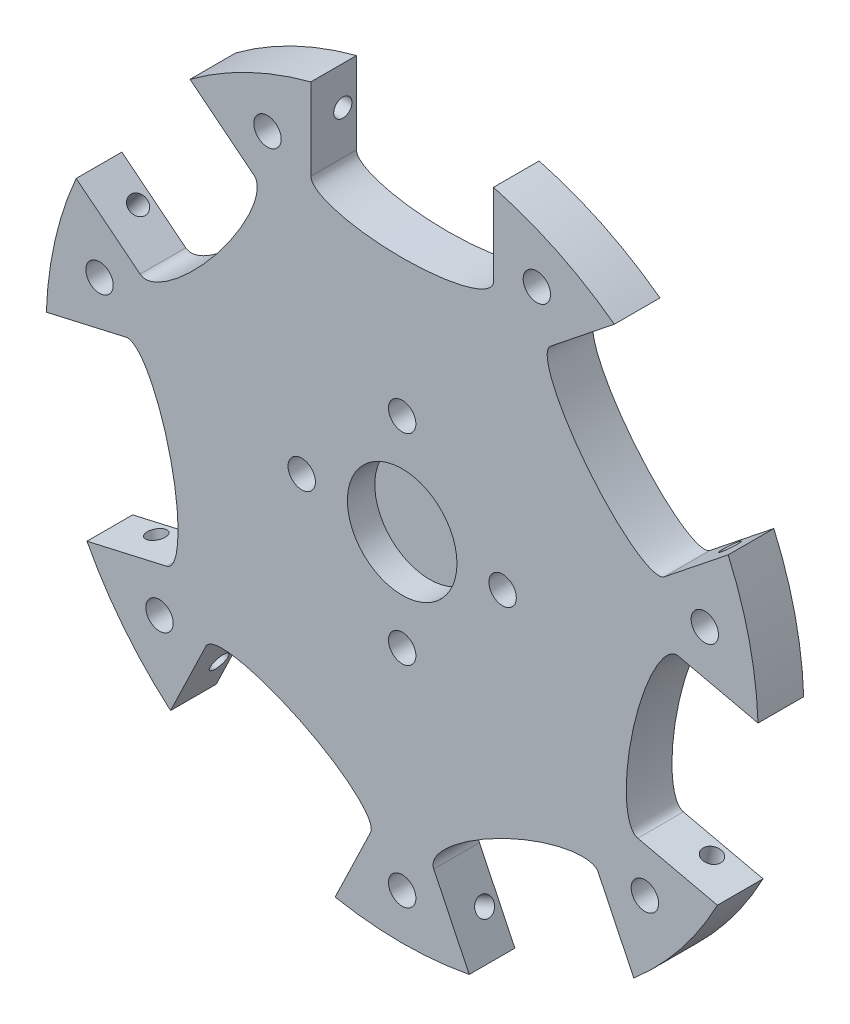
from build123d import *

# Parameters (mm, degrees)
EXTRUDE_2_DEPTH          = 5
SKETCH_3_R               = 1.5
SKETCH_3_R_2             = 6
CUT_EXTRUDE_2_DEPTH      = 3
SKETCH_6_R               = 1
CUT_EXTRUDE_5_DEPTH      = 13
PATTERN_CIRCULAR_1_COUNT = 7
SCALE_1_DEPTH            = 5
SCALE_1_2_DEPTH          = 0.783063807
SCALE_START              = 4.198063807
SCALE_1_3_OUTLINE_R      = 1.5
SCALE_1_3_OUTLINE_R_2    = 6
SCALE_1_3_DEPTH          = 0.801936193
SCALE_START_2            = 2.149063807
SCALE_1_4_OUTLINE_R      = 1.0245
SCALE_1_4_DEPTH          = 2.049
SCALE_START_3            = 2
SCALE_1_5_OUTLINE_R      = 1.5
SCALE_1_5_OUTLINE_R_2    = 6
SCALE_1_5_OUTLINE_R_3    = 4.098
SCALE_1_5_DEPTH          = 2.198063807
SCALE_1_6_OUTLINE_R      = 4.098
SCALE_1_6_DEPTH          = 0.149063807


with BuildPart() as part:
    # 草图1 → 凸台-拉伸2 (new body)
    with BuildSketch(Plane.XY):
        with BuildLine():
            Line((-10, 28.75), (-10, 37.69615365))
            ThreePointArc((-10, 37.69615365), (-16.921465826, 35.137785848), (-23.237141673, 31.321482195))
            Line((-23.237141673, 31.321482195), (-16.242757102, 25.743646628))
            add(Edge.make_bspline(
                [(-28.71255314, 10.107016979), (-26.562516563, 8.392420024), (-20.327618544, 16.210734848), (-14.092720526, 24.029049673), (-16.242757102, 25.743646628)],
                knots=[3.141592654, 3.141592654, 3.141592654, 4.71238898, 4.71238898, 6.283185307, 6.283185307, 6.283185307], degree=2, weights=[1, 0.707106781, 1, 0.707106781, 1]))
            Line((-28.71255314, 10.107016979), (-35.70693771, 15.684852545))
            ThreePointArc((-35.70693771, 15.684852545), (-38.022188575, 8.678316424), (-38.976241715, 1.361095805))
            Line((-38.976241715, 1.361095805), (-30.254386815, 3.351802271))
            add(Edge.make_bspline(
                [(-25.803968136, -16.146755973), (-23.122916377, -15.534823405), (-25.348125717, -5.785544283), (-27.573335056, 3.963734839), (-30.254386815, 3.351802271)],
                knots=[3.141592654, 3.141592654, 3.141592654, 4.71238898, 4.71238898, 6.283185307, 6.283185307, 6.283185307], degree=2, weights=[1, 0.707106781, 1, 0.707106781, 1]))
            Line((-25.803968136, -16.146755973), (-34.525823036, -18.137462439))
            ThreePointArc((-34.525823036, -18.137462439), (-30.491427816, -24.316102272), (-25.365436775, -29.624223487))
            Line((-25.365436775, -29.624223487), (-21.483846179, -21.564017561))
            add(Edge.make_bspline(
                [(-3.464468821, -30.241692343), (-2.271288538, -27.764027957), (-11.280977217, -23.425190565), (-20.290665896, -19.086353174), (-21.483846179, -21.564017561)],
                knots=[3.141592654, 3.141592654, 3.141592654, 4.71238898, 4.71238898, 6.283185307, 6.283185307, 6.283185307], degree=2, weights=[1, 0.707106781, 1, 0.707106781, 1]))
            Line((-3.464468821, -30.241692343), (-7.346059417, -38.301898269))
            ThreePointArc((-7.346059417, -38.301898269), (0, -39), (7.346059417, -38.301898269))
            Line((7.346059417, -38.301898269), (3.464468821, -30.241692343))
            add(Edge.make_bspline(
                [(21.483846179, -21.564017561), (20.290665896, -19.086353174), (11.280977217, -23.425190565), (2.271288538, -27.764027957), (3.464468821, -30.241692343)],
                knots=[3.141592654, 3.141592654, 3.141592654, 4.71238898, 4.71238898, 6.283185307, 6.283185307, 6.283185307], degree=2, weights=[1, 0.707106781, 1, 0.707106781, 1]))
            Line((21.483846179, -21.564017561), (25.365436775, -29.624223487))
            ThreePointArc((25.365436775, -29.624223487), (30.491427816, -24.316102272), (34.525823036, -18.137462439))
            Line((34.525823036, -18.137462439), (25.803968136, -16.146755973))
            add(Edge.make_bspline(
                [(30.254386815, 3.351802271), (27.573335056, 3.963734839), (25.348125717, -5.785544283), (23.122916377, -15.534823405), (25.803968136, -16.146755973)],
                knots=[3.141592654, 3.141592654, 3.141592654, 4.71238898, 4.71238898, 6.283185307, 6.283185307, 6.283185307], degree=2, weights=[1, 0.707106781, 1, 0.707106781, 1]))
            Line((30.254386815, 3.351802271), (38.976241715, 1.361095805))
            ThreePointArc((38.976241715, 1.361095805), (38.022188575, 8.678316424), (35.70693771, 15.684852545))
            Line((35.70693771, 15.684852545), (28.71255314, 10.107016979))
            add(Edge.make_bspline(
                [(16.242757102, 25.743646628), (14.092720526, 24.029049673), (20.327618544, 16.210734848), (26.562516563, 8.392420024), (28.71255314, 10.107016979)],
                knots=[3.141592654, 3.141592654, 3.141592654, 4.71238898, 4.71238898, 6.283185307, 6.283185307, 6.283185307], degree=2, weights=[1, 0.707106781, 1, 0.707106781, 1]))
            Line((16.242757102, 25.743646628), (23.237141673, 31.321482195))
            ThreePointArc((23.237141673, 31.321482195), (16.921465826, 35.137785848), (10, 37.69615365))
            Line((10, 37.69615365), (10, 28.75))
            add(Edge.make_bspline(
                [(-10, 28.75), (-10, 26), (0, 26), (10, 26), (10, 28.75)],
                knots=[3.141592654, 3.141592654, 3.141592654, 4.71238898, 4.71238898, 6.283185307, 6.283185307, 6.283185307], degree=2, weights=[1, 0.707106781, 1, 0.707106781, 1]))
        make_face()
    extrude(amount=EXTRUDE_2_DEPTH)

    # 草图3 → 切除-拉伸2 (cut)
    with BuildSketch(Plane.XY.offset(5)):
        with Locations((0, 11)):
            Circle(SKETCH_3_R)
        with Locations((11, 0)):
            Circle(SKETCH_3_R)
        with Locations((0, -11)):
            Circle(SKETCH_3_R)
        with Locations((-11, 0)):
            Circle(SKETCH_3_R)
        Circle(SKETCH_3_R_2)
        with Locations((14.75204713, 30.632941509)):
            Circle(SKETCH_3_R)
        with Locations((33.147549014, 7.565711755)):
            Circle(SKETCH_3_R)
        with Locations((26.582270404, -21.198653263)):
            Circle(SKETCH_3_R)
        with Locations((0, -34)):
            Circle(SKETCH_3_R)
        with Locations((-26.582270404, -21.198653263)):
            Circle(SKETCH_3_R)
        with Locations((-33.147549014, 7.565711755)):
            Circle(SKETCH_3_R)
        with Locations((-14.75204713, 30.632941509)):
            Circle(SKETCH_3_R)
    extrude(amount=-CUT_EXTRUDE_2_DEPTH, mode=Mode.SUBTRACT)

    # 草图6 → 切除-拉伸5 (cut, symmetric)
    with BuildSketch(Plane(origin=(0, 0, 0), x_dir=(0, 0, -1), z_dir=(1, 0, 0))):
        with Locations((-1.5, 33.5)):
            Circle(SKETCH_6_R)
    cut_extrude_5 = extrude(amount=CUT_EXTRUDE_5_DEPTH, both=True, mode=Mode.SUBTRACT)

    # 阵列(圆周)1: 切除-拉伸5 ×7 about axis
    pattern_circular_1_axis = Axis((0, 0, 0), (0, 0, 1))
    for i in range(1, PATTERN_CIRCULAR_1_COUNT):
        add(cut_extrude_5.rotate(pattern_circular_1_axis, i * 360 / PATTERN_CIRCULAR_1_COUNT), mode=Mode.SUBTRACT)

    # 缩放比例1: read off the stored shape, not the designer's step
    # 缩放比例1 outline → 缩放比例1 (cut)
    with BuildSketch(Plane.XY):
        with BuildLine():
            Line((10, 37.69615365), (10, 28.75))
            add(Edge.make_bspline(
                [(10, 28.75), (10, 26), (0, 26), (-10, 26), (-10, 28.75)],
                knots=[0, 0, 0, 1.570796327, 1.570796327, 3.141592654, 3.141592654, 3.141592654], degree=2, weights=[1, 0.707106781, 1, 0.707106781, 1]))
            Line((-10, 28.75), (-10, 37.69615365))
            ThreePointArc((-10, 37.69615365), (-16.921465826, 35.137785848), (-23.237141673, 31.321482195))
            Line((-23.237141673, 31.321482195), (-16.242757102, 25.743646628))
            add(Edge.make_bspline(
                [(-16.242757102, 25.743646628), (-14.092720526, 24.029049673), (-20.327618544, 16.210734848), (-26.562516563, 8.392420024), (-28.71255314, 10.107016979)],
                knots=[0, 0, 0, 1.570796327, 1.570796327, 3.141592654, 3.141592654, 3.141592654], degree=2, weights=[1, 0.707106781, 1, 0.707106781, 1]))
            Line((-28.71255314, 10.107016979), (-35.70693771, 15.684852545))
            ThreePointArc((-35.70693771, 15.684852545), (-38.022188575, 8.678316424), (-38.976241715, 1.361095805))
            Line((-38.976241715, 1.361095805), (-30.254386815, 3.351802271))
            add(Edge.make_bspline(
                [(-30.254386815, 3.351802271), (-27.573335056, 3.963734839), (-25.348125717, -5.785544283), (-23.122916377, -15.534823405), (-25.803968136, -16.146755973)],
                knots=[0, 0, 0, 1.570796327, 1.570796327, 3.141592654, 3.141592654, 3.141592654], degree=2, weights=[1, 0.707106781, 1, 0.707106781, 1]))
            Line((-25.803968136, -16.146755973), (-34.525823036, -18.137462439))
            ThreePointArc((-34.525823036, -18.137462439), (-30.491427816, -24.316102272), (-25.365436775, -29.624223487))
            Line((-25.365436775, -29.624223487), (-21.483846179, -21.564017561))
            add(Edge.make_bspline(
                [(-21.483846179, -21.564017561), (-20.290665896, -19.086353174), (-11.280977217, -23.425190565), (-2.271288538, -27.764027957), (-3.464468821, -30.241692343)],
                knots=[0, 0, 0, 1.570796327, 1.570796327, 3.141592654, 3.141592654, 3.141592654], degree=2, weights=[1, 0.707106781, 1, 0.707106781, 1]))
            Line((-3.464468821, -30.241692343), (-7.346059417, -38.301898269))
            ThreePointArc((-7.346059417, -38.301898269), (0, -39), (7.346059417, -38.301898269))
            Line((7.346059417, -38.301898269), (3.464468821, -30.241692343))
            add(Edge.make_bspline(
                [(3.464468821, -30.241692343), (2.271288538, -27.764027957), (11.280977217, -23.425190565), (20.290665896, -19.086353174), (21.483846179, -21.564017561)],
                knots=[0, 0, 0, 1.570796327, 1.570796327, 3.141592654, 3.141592654, 3.141592654], degree=2, weights=[1, 0.707106781, 1, 0.707106781, 1]))
            Line((21.483846179, -21.564017561), (25.365436775, -29.624223487))
            ThreePointArc((25.365436775, -29.624223487), (30.491427816, -24.316102272), (34.525823036, -18.137462439))
            Line((34.525823036, -18.137462439), (25.803968136, -16.146755973))
            add(Edge.make_bspline(
                [(25.803968136, -16.146755973), (23.122916377, -15.534823405), (25.348125717, -5.785544283), (27.573335056, 3.963734839), (30.254386815, 3.351802271)],
                knots=[0, 0, 0, 1.570796327, 1.570796327, 3.141592654, 3.141592654, 3.141592654], degree=2, weights=[1, 0.707106781, 1, 0.707106781, 1]))
            Line((30.254386815, 3.351802271), (38.976241715, 1.361095805))
            ThreePointArc((38.976241715, 1.361095805), (38.022188575, 8.678316424), (35.70693771, 15.684852545))
            Line((35.70693771, 15.684852545), (28.71255314, 10.107016979))
            add(Edge.make_bspline(
                [(28.71255314, 10.107016979), (26.562516563, 8.392420024), (20.327618544, 16.210734848), (14.092720526, 24.029049673), (16.242757102, 25.743646628)],
                knots=[0, 0, 0, 1.570796327, 1.570796327, 3.141592654, 3.141592654, 3.141592654], degree=2, weights=[1, 0.707106781, 1, 0.707106781, 1]))
            Line((16.242757102, 25.743646628), (23.237141673, 31.321482195))
            ThreePointArc((23.237141673, 31.321482195), (16.921465826, 35.137785848), (10, 37.69615365))
        make_face()
        with BuildLine():
            add(Edge.make_bspline(
                [(6.829999977, 19.636255773), (6.829999977, 17.758005773), (-2.3e-08, 17.758005773), (-6.830000023, 17.758005773), (-6.830000023, 19.636255773)],
                knots=[0, 0, 0, 1.570796327, 1.570796327, 3.141592654, 3.141592654, 3.141592654], degree=2, weights=[1, 0.707106781, 1, 0.707106781, 1]))
            Line((6.829999977, 19.636255773), (6.829999977, 25.746478716))
            ThreePointArc((6.829999977, 25.746478716), (11.557361136, 23.999113507), (15.87096774, 21.392578112))
            Line((15.87096774, 21.392578112), (11.093803078, 17.58291642))
            add(Edge.make_bspline(
                [(19.610673772, 6.903098369), (18.14219879, 5.732028649), (13.883763443, 11.071937674), (9.625328096, 16.411846699), (11.093803078, 17.58291642)],
                knots=[0, 0, 0, 1.570796327, 1.570796327, 3.141592654, 3.141592654, 3.141592654], degree=2, weights=[1, 0.707106781, 1, 0.707106781, 1]))
            Line((19.610673772, 6.903098369), (24.387838433, 10.712760061))
            ThreePointArc((24.387838433, 10.712760061), (25.969154774, 5.927295891), (26.620773069, 0.929634208))
            Line((26.620773069, 0.929634208), (20.663746172, 2.289286724))
            add(Edge.make_bspline(
                [(17.624110214, -11.028228557), (15.792951863, -10.610278613), (17.312769842, -3.951520972), (18.832587821, 2.707236668), (20.663746172, 2.289286724)],
                knots=[0, 0, 0, 1.570796327, 1.570796327, 3.141592654, 3.141592654, 3.141592654], degree=2, weights=[1, 0.707106781, 1, 0.707106781, 1]))
            Line((17.624110214, -11.028228557), (23.581137111, -12.387881073))
            ThreePointArc((23.581137111, -12.387881073), (20.825645176, -16.607892079), (17.324593295, -20.233338869))
            Line((17.324593295, -20.233338869), (14.673466917, -14.728218221))
            add(Edge.make_bspline(
                [(2.366232182, -20.655070098), (1.551290049, -18.962825322), (7.704907417, -15.999399383), (13.858524784, -13.035973445), (14.673466917, -14.728218221)],
                knots=[0, 0, 0, 1.570796327, 1.570796327, 3.141592654, 3.141592654, 3.141592654], degree=2, weights=[1, 0.707106781, 1, 0.707106781, 1]))
            Line((2.366232182, -20.655070098), (5.017358559, -26.160190745))
            ThreePointArc((5.017358559, -26.160190745), (-2.3e-08, -26.636994227), (-5.017358604, -26.160190745))
            Line((-5.017358604, -26.160190745), (-2.366232227, -20.655070098))
            add(Edge.make_bspline(
                [(-14.673466963, -14.728218221), (-13.85852483, -13.035973445), (-7.704907462, -15.999399383), (-1.551290094, -18.962825322), (-2.366232227, -20.655070098)],
                knots=[0, 0, 0, 1.570796327, 1.570796327, 3.141592654, 3.141592654, 3.141592654], degree=2, weights=[1, 0.707106781, 1, 0.707106781, 1]))
            Line((-14.673466963, -14.728218221), (-17.32459334, -20.233338869))
            ThreePointArc((-17.32459334, -20.233338869), (-20.825645221, -16.607892079), (-23.581137156, -12.387881073))
            Line((-23.581137156, -12.387881073), (-17.624110259, -11.028228557))
            add(Edge.make_bspline(
                [(-20.663746217, 2.289286724), (-18.832587866, 2.707236668), (-17.312769887, -3.951520972), (-15.792951908, -10.610278613), (-17.624110259, -11.028228557)],
                knots=[0, 0, 0, 1.570796327, 1.570796327, 3.141592654, 3.141592654, 3.141592654], degree=2, weights=[1, 0.707106781, 1, 0.707106781, 1]))
            Line((-20.663746217, 2.289286724), (-26.620773114, 0.929634208))
            ThreePointArc((-26.620773114, 0.929634208), (-25.969154819, 5.92729589), (-24.387838479, 10.712760061))
            Line((-24.387838479, 10.712760061), (-19.610673817, 6.903098369))
            add(Edge.make_bspline(
                [(-11.093803124, 17.58291642), (-9.625328142, 16.411846699), (-13.883763488, 11.071937674), (-18.142198835, 5.732028649), (-19.610673817, 6.903098369)],
                knots=[0, 0, 0, 1.570796327, 1.570796327, 3.141592654, 3.141592654, 3.141592654], degree=2, weights=[1, 0.707106781, 1, 0.707106781, 1]))
            Line((-11.093803124, 17.58291642), (-15.870967785, 21.392578112))
            ThreePointArc((-15.870967785, 21.392578112), (-11.557361182, 23.999113507), (-6.830000023, 25.746478716))
            Line((-6.830000023, 25.746478716), (-6.830000023, 19.636255773))
        make_face(mode=Mode.SUBTRACT)
    extrude(amount=SCALE_1_DEPTH, mode=Mode.SUBTRACT)

    # Scale 1 2 outline → Scale 1 2 (cut)
    with BuildSketch(Plane.XY):
        with BuildLine():
            Line((6.829999977, 25.746478716), (6.829999977, 19.636255773))
            add(Edge.make_bspline(
                [(6.829999977, 19.636255773), (6.829999977, 17.758005773), (-2.3e-08, 17.758005773), (-6.830000023, 17.758005773), (-6.830000023, 19.636255773)],
                knots=[0, 0, 0, 1.570796327, 1.570796327, 3.141592654, 3.141592654, 3.141592654], degree=2, weights=[1, 0.707106781, 1, 0.707106781, 1]))
            Line((-6.830000023, 19.636255773), (-6.830000023, 25.746478716))
            ThreePointArc((-6.830000023, 25.746478716), (-11.557361182, 23.999113507), (-15.870967785, 21.392578112))
            Line((-15.870967785, 21.392578112), (-11.093803124, 17.58291642))
            add(Edge.make_bspline(
                [(-11.093803124, 17.58291642), (-9.625328142, 16.411846699), (-13.883763488, 11.071937674), (-18.142198835, 5.732028649), (-19.610673817, 6.903098369)],
                knots=[0, 0, 0, 1.570796327, 1.570796327, 3.141592654, 3.141592654, 3.141592654], degree=2, weights=[1, 0.707106781, 1, 0.707106781, 1]))
            Line((-19.610673817, 6.903098369), (-24.387838479, 10.712760061))
            ThreePointArc((-24.387838479, 10.712760061), (-25.969154819, 5.92729589), (-26.620773114, 0.929634208))
            Line((-26.620773114, 0.929634208), (-20.663746217, 2.289286724))
            add(Edge.make_bspline(
                [(-20.663746217, 2.289286724), (-18.832587866, 2.707236668), (-17.312769887, -3.951520972), (-15.792951908, -10.610278613), (-17.624110259, -11.028228557)],
                knots=[0, 0, 0, 1.570796327, 1.570796327, 3.141592654, 3.141592654, 3.141592654], degree=2, weights=[1, 0.707106781, 1, 0.707106781, 1]))
            Line((-17.624110259, -11.028228557), (-23.581137156, -12.387881073))
            ThreePointArc((-23.581137156, -12.387881073), (-20.825645221, -16.607892079), (-17.32459334, -20.233338869))
            Line((-17.32459334, -20.233338869), (-14.673466963, -14.728218221))
            add(Edge.make_bspline(
                [(-14.673466963, -14.728218221), (-13.85852483, -13.035973445), (-7.704907462, -15.999399383), (-1.551290094, -18.962825322), (-2.366232227, -20.655070098)],
                knots=[0, 0, 0, 1.570796327, 1.570796327, 3.141592654, 3.141592654, 3.141592654], degree=2, weights=[1, 0.707106781, 1, 0.707106781, 1]))
            Line((-2.366232227, -20.655070098), (-5.017358604, -26.160190745))
            ThreePointArc((-5.017358604, -26.160190745), (-2.3e-08, -26.636994227), (5.017358559, -26.160190745))
            Line((5.017358559, -26.160190745), (2.366232182, -20.655070098))
            add(Edge.make_bspline(
                [(2.366232182, -20.655070098), (1.551290049, -18.962825322), (7.704907417, -15.999399383), (13.858524784, -13.035973445), (14.673466917, -14.728218221)],
                knots=[0, 0, 0, 1.570796327, 1.570796327, 3.141592654, 3.141592654, 3.141592654], degree=2, weights=[1, 0.707106781, 1, 0.707106781, 1]))
            Line((14.673466917, -14.728218221), (17.324593295, -20.233338869))
            ThreePointArc((17.324593295, -20.233338869), (20.825645176, -16.607892079), (23.581137111, -12.387881073))
            Line((23.581137111, -12.387881073), (17.624110214, -11.028228557))
            add(Edge.make_bspline(
                [(17.624110214, -11.028228557), (15.792951863, -10.610278613), (17.312769842, -3.951520972), (18.832587821, 2.707236668), (20.663746172, 2.289286724)],
                knots=[0, 0, 0, 1.570796327, 1.570796327, 3.141592654, 3.141592654, 3.141592654], degree=2, weights=[1, 0.707106781, 1, 0.707106781, 1]))
            Line((20.663746172, 2.289286724), (26.620773069, 0.929634208))
            ThreePointArc((26.620773069, 0.929634208), (25.969154774, 5.927295891), (24.387838433, 10.712760061))
            Line((24.387838433, 10.712760061), (19.610673772, 6.903098369))
            add(Edge.make_bspline(
                [(19.610673772, 6.903098369), (18.14219879, 5.732028649), (13.883763443, 11.071937674), (9.625328096, 16.411846699), (11.093803078, 17.58291642)],
                knots=[0, 0, 0, 1.570796327, 1.570796327, 3.141592654, 3.141592654, 3.141592654], degree=2, weights=[1, 0.707106781, 1, 0.707106781, 1]))
            Line((11.093803078, 17.58291642), (15.87096774, 21.392578112))
            ThreePointArc((15.87096774, 21.392578112), (11.557361136, 23.999113507), (6.829999977, 25.746478716))
        make_face()
    extrude(amount=SCALE_1_2_DEPTH, mode=Mode.SUBTRACT)

    # Scale 1 3 outline → Scale 1 3 (cut)
    with BuildSketch(Plane.XY.offset(SCALE_START)):
        with BuildLine():
            Line((6.829999977, 25.746478716), (6.829999977, 19.636255773))
            add(Edge.make_bspline(
                [(6.829999977, 19.636255773), (6.829999977, 17.758005773), (-2.3e-08, 17.758005773), (-6.830000023, 17.758005773), (-6.830000023, 19.636255773)],
                knots=[0, 0, 0, 1.570796327, 1.570796327, 3.141592654, 3.141592654, 3.141592654], degree=2, weights=[1, 0.707106781, 1, 0.707106781, 1]))
            Line((-6.830000023, 19.636255773), (-6.830000023, 25.746478716))
            ThreePointArc((-6.830000023, 25.746478716), (-11.557361182, 23.999113507), (-15.870967785, 21.392578112))
            Line((-15.870967785, 21.392578112), (-11.093803124, 17.58291642))
            add(Edge.make_bspline(
                [(-11.093803124, 17.58291642), (-9.625328142, 16.411846699), (-13.883763488, 11.071937674), (-18.142198835, 5.732028649), (-19.610673817, 6.903098369)],
                knots=[0, 0, 0, 1.570796327, 1.570796327, 3.141592654, 3.141592654, 3.141592654], degree=2, weights=[1, 0.707106781, 1, 0.707106781, 1]))
            Line((-19.610673817, 6.903098369), (-24.387838479, 10.712760061))
            ThreePointArc((-24.387838479, 10.712760061), (-25.969154819, 5.92729589), (-26.620773114, 0.929634208))
            Line((-26.620773114, 0.929634208), (-20.663746217, 2.289286724))
            add(Edge.make_bspline(
                [(-20.663746217, 2.289286724), (-18.832587866, 2.707236668), (-17.312769887, -3.951520972), (-15.792951908, -10.610278613), (-17.624110259, -11.028228557)],
                knots=[0, 0, 0, 1.570796327, 1.570796327, 3.141592654, 3.141592654, 3.141592654], degree=2, weights=[1, 0.707106781, 1, 0.707106781, 1]))
            Line((-17.624110259, -11.028228557), (-23.581137156, -12.387881073))
            ThreePointArc((-23.581137156, -12.387881073), (-20.825645221, -16.607892079), (-17.32459334, -20.233338869))
            Line((-17.32459334, -20.233338869), (-14.673466963, -14.728218221))
            add(Edge.make_bspline(
                [(-14.673466963, -14.728218221), (-13.85852483, -13.035973445), (-7.704907462, -15.999399383), (-1.551290094, -18.962825322), (-2.366232227, -20.655070098)],
                knots=[0, 0, 0, 1.570796327, 1.570796327, 3.141592654, 3.141592654, 3.141592654], degree=2, weights=[1, 0.707106781, 1, 0.707106781, 1]))
            Line((-2.366232227, -20.655070098), (-5.017358604, -26.160190745))
            ThreePointArc((-5.017358604, -26.160190745), (-2.3e-08, -26.636994227), (5.017358559, -26.160190745))
            Line((5.017358559, -26.160190745), (2.366232182, -20.655070098))
            add(Edge.make_bspline(
                [(2.366232182, -20.655070098), (1.551290049, -18.962825322), (7.704907417, -15.999399383), (13.858524784, -13.035973445), (14.673466917, -14.728218221)],
                knots=[0, 0, 0, 1.570796327, 1.570796327, 3.141592654, 3.141592654, 3.141592654], degree=2, weights=[1, 0.707106781, 1, 0.707106781, 1]))
            Line((14.673466917, -14.728218221), (17.324593295, -20.233338869))
            ThreePointArc((17.324593295, -20.233338869), (20.825645176, -16.607892079), (23.581137111, -12.387881073))
            Line((23.581137111, -12.387881073), (17.624110214, -11.028228557))
            add(Edge.make_bspline(
                [(17.624110214, -11.028228557), (15.792951863, -10.610278613), (17.312769842, -3.951520972), (18.832587821, 2.707236668), (20.663746172, 2.289286724)],
                knots=[0, 0, 0, 1.570796327, 1.570796327, 3.141592654, 3.141592654, 3.141592654], degree=2, weights=[1, 0.707106781, 1, 0.707106781, 1]))
            Line((20.663746172, 2.289286724), (26.620773069, 0.929634208))
            ThreePointArc((26.620773069, 0.929634208), (25.969154774, 5.927295891), (24.387838433, 10.712760061))
            Line((24.387838433, 10.712760061), (19.610673772, 6.903098369))
            add(Edge.make_bspline(
                [(19.610673772, 6.903098369), (18.14219879, 5.732028649), (13.883763443, 11.071937674), (9.625328096, 16.411846699), (11.093803078, 17.58291642)],
                knots=[0, 0, 0, 1.570796327, 1.570796327, 3.141592654, 3.141592654, 3.141592654], degree=2, weights=[1, 0.707106781, 1, 0.707106781, 1]))
            Line((11.093803078, 17.58291642), (15.87096774, 21.392578112))
            ThreePointArc((15.87096774, 21.392578112), (11.557361136, 23.999113507), (6.829999977, 25.746478716))
        make_face()
        with Locations((0, -11)):
            Circle(SCALE_1_3_OUTLINE_R, mode=Mode.SUBTRACT)
        with Locations((-11, 0)):
            Circle(SCALE_1_3_OUTLINE_R, mode=Mode.SUBTRACT)
        Circle(SCALE_1_3_OUTLINE_R_2, mode=Mode.SUBTRACT)
        with Locations((0, 11)):
            Circle(SCALE_1_3_OUTLINE_R, mode=Mode.SUBTRACT)
        with Locations((11, 0)):
            Circle(SCALE_1_3_OUTLINE_R, mode=Mode.SUBTRACT)
    extrude(amount=SCALE_1_3_DEPTH, mode=Mode.SUBTRACT)

    # Scale 1 4 outline → Scale 1 4 (cut)
    with BuildSketch(Plane.XY.offset(SCALE_START_2)):
        with Locations((-2.3e-08, 7.513005773)):
            Circle(SCALE_1_4_OUTLINE_R)
        with Locations((-2.3e-08, -23.221994227)):
            Circle(SCALE_1_4_OUTLINE_R)
        with Locations((18.155690663, -14.478674406)):
            Circle(SCALE_1_4_OUTLINE_R)
        with Locations((22.639775954, 5.167386901)):
            Circle(SCALE_1_4_OUTLINE_R)
        with Locations((10.075648167, 20.922304823)):
            Circle(SCALE_1_4_OUTLINE_R)
        with Locations((7.512999977, 5.773e-06)):
            Circle(SCALE_1_4_OUTLINE_R)
        with Locations((-2.3e-08, -7.512994227)):
            Circle(SCALE_1_4_OUTLINE_R)
        with Locations((-7.513000023, 5.773e-06)):
            Circle(SCALE_1_4_OUTLINE_R)
        with Locations((-18.155690709, -14.478674406)):
            Circle(SCALE_1_4_OUTLINE_R)
        with Locations((-22.639775999, 5.167386901)):
            Circle(SCALE_1_4_OUTLINE_R)
        with Locations((-10.075648212, 20.922304823)):
            Circle(SCALE_1_4_OUTLINE_R)
    extrude(amount=SCALE_1_4_DEPTH, mode=Mode.SUBTRACT)

    # Scale 1 5 outline → Scale 1 5 (add)
    # profile 1 of 5: a face of its own
    with BuildSketch(Plane.XY.offset(SCALE_START_3)):
        with Locations((0, 11)):
            Circle(SCALE_1_5_OUTLINE_R)
    # profile 2 of 5: a face of its own
    with BuildSketch(Plane.XY.offset(SCALE_START_3)):
        Circle(SCALE_1_5_OUTLINE_R_2)
        with Locations((-2.3e-08, 5.773e-06)):
            Circle(SCALE_1_5_OUTLINE_R_3, mode=Mode.SUBTRACT)
    # profile 3 of 5: a face of its own
    with BuildSketch(Plane.XY.offset(SCALE_START_3)):
        with Locations((11, 0)):
            Circle(SCALE_1_5_OUTLINE_R)
    # profile 4 of 5: a face of its own
    with BuildSketch(Plane.XY.offset(SCALE_START_3)):
        with Locations((0, -11)):
            Circle(SCALE_1_5_OUTLINE_R)
    # profile 5 of 5: a face of its own
    with BuildSketch(Plane.XY.offset(SCALE_START_3)):
        with Locations((-11, 0)):
            Circle(SCALE_1_5_OUTLINE_R)
    extrude(amount=SCALE_1_5_DEPTH)

    # Scale 1 6 outline → Scale 1 6 (add)
    with BuildSketch(Plane.XY.offset(SCALE_START_3)):
        with Locations((-2.3e-08, 5.773e-06)):
            Circle(SCALE_1_6_OUTLINE_R)
    extrude(amount=SCALE_1_6_DEPTH)

    # Scale 1 7: loft between two sections, ruled curve by curve
    scale_1_7_from = [
        Edge.make_three_point_arc((6.829999977, 22.880505773, 1.124563807), (6.829999977, 23.563505773, 1.807563807), (6.829999977, 22.880505773, 2.490563807)),
        Edge.make_three_point_arc((6.829999977, 22.880505773, 2.490563807), (6.829999977, 22.197505773, 1.807563807), (6.829999977, 22.880505773, 1.124563807)),
    ]
    scale_1_7_to = [
        Edge.make_three_point_arc((8.878999977, 22.880505773, 1.124563807), (8.878999977, 23.563505773, 1.807563807), (8.878999977, 22.880505773, 2.490563807)),
        Edge.make_three_point_arc((8.878999977, 22.880505773, 2.490563807), (8.878999977, 22.197505773, 1.807563807), (8.878999977, 22.880505773, 1.124563807)),
    ]
    scale_1_7 = Solid(Shell([*[Face.make_surface_from_curves(scale_1_7_from[k], scale_1_7_to[k]) for k in range(2)], Face(Wire(scale_1_7_from)), Face(Wire(scale_1_7_to))]))
    add(scale_1_7, mode=Mode.SUBTRACT)

    # Scale 1 8: loft between two sections, ruled curve by curve
    scale_1_8_from = [
        Edge.make_three_point_arc((-8.879000023, 22.880505773, 1.124563807), (-8.879000023, 23.563505773, 1.807563807), (-8.879000023, 22.880505773, 2.490563807)),
        Edge.make_three_point_arc((-8.879000023, 22.880505773, 2.490563807), (-8.879000023, 22.197505773, 1.807563807), (-8.879000023, 22.880505773, 1.124563807)),
    ]
    scale_1_8_to = [
        Edge.make_three_point_arc((-6.830000023, 22.880505773, 1.124563807), (-6.830000023, 23.563505773, 1.807563807), (-6.830000023, 22.880505773, 2.490563807)),
        Edge.make_three_point_arc((-6.830000023, 22.880505773, 2.490563807), (-6.830000023, 22.197505773, 1.807563807), (-6.830000023, 22.880505773, 1.124563807)),
    ]
    scale_1_8 = Solid(Shell([*[Face.make_surface_from_curves(scale_1_8_from[k], scale_1_8_to[k]) for k in range(2)], Face(Wire(scale_1_8_from)), Face(Wire(scale_1_8_to))]))
    add(scale_1_8, mode=Mode.SUBTRACT)

    # Scale 1 9: loft between two sections, ruled curve by curve
    scale_1_9_from = [
        Edge.make_three_point_arc((12.352729261, 21.207645917, 1.124563807), (12.886720164, 21.633489452, 1.807563807), (12.352729261, 21.207645917, 2.490563807)),
        Edge.make_three_point_arc((12.352729261, 21.207645917, 2.490563807), (11.818738359, 20.781802382, 1.807563807), (12.352729261, 21.207645917, 1.124563807)),
    ]
    scale_1_9_to = [
        Edge.make_three_point_arc((13.630259865, 19.605673209, 1.124563807), (14.164250768, 20.031516744, 1.807563807), (13.630259865, 19.605673209, 2.490563807)),
        Edge.make_three_point_arc((13.630259865, 19.605673209, 2.490563807), (13.096268963, 19.179829675, 1.807563807), (13.630259865, 19.605673209, 1.124563807)),
    ]
    scale_1_9 = Solid(Shell([*[Face.make_surface_from_curves(scale_1_9_from[k], scale_1_9_to[k]) for k in range(2)], Face(Wire(scale_1_9_from)), Face(Wire(scale_1_9_to))]))
    add(scale_1_9, mode=Mode.SUBTRACT)

    # Scale 1 10: loft between two sections, ruled curve by curve
    scale_1_10_from = [
        Edge.make_three_point_arc((22.681121461, 9.351698694, 1.807563807), (22.147130559, 8.925855159, 2.490563807), (21.613139656, 8.500011624, 1.807563807)),
        Edge.make_three_point_arc((21.613139656, 8.500011624, 1.807563807), (22.147130559, 8.925855159, 1.124563807), (22.681121461, 9.351698694, 1.807563807)),
    ]
    scale_1_10_to = [
        Edge.make_three_point_arc((23.958652065, 7.749725986, 1.807563807), (23.424661163, 7.323882451, 2.490563807), (22.89067026, 6.898038917, 1.807563807)),
        Edge.make_three_point_arc((22.89067026, 6.898038917, 1.807563807), (23.424661163, 7.323882451, 1.124563807), (23.958652065, 7.749725986, 1.807563807)),
    ]
    scale_1_10 = Solid(Shell([*[Face.make_surface_from_curves(scale_1_10_from[k], scale_1_10_to[k]) for k in range(2)], Face(Wire(scale_1_10_from)), Face(Wire(scale_1_10_to))]))
    add(scale_1_10, mode=Mode.SUBTRACT)

    # Scale 1 11: loft between two sections, ruled curve by curve
    scale_1_11_from = [
        Edge.make_three_point_arc((24.948477209, 3.413018678, 1.807563807), (24.282601445, 3.565000476, 2.490563807), (23.616725681, 3.716982274, 1.807563807)),
        Edge.make_three_point_arc((23.616725681, 3.716982274, 1.807563807), (24.282601445, 3.565000476, 1.124563807), (24.948477209, 3.413018678, 1.807563807)),
    ]
    scale_1_11_to = [
        Edge.make_three_point_arc((24.492531815, 1.415391386, 1.807563807), (23.826656051, 1.567373184, 2.490563807), (23.160780287, 1.719354981, 1.807563807)),
        Edge.make_three_point_arc((23.160780287, 1.719354981, 1.807563807), (23.826656051, 1.567373184, 1.124563807), (24.492531815, 1.415391386, 1.807563807)),
    ]
    scale_1_11 = Solid(Shell([*[Face.make_surface_from_curves(scale_1_11_from[k], scale_1_11_to[k]) for k in range(2)], Face(Wire(scale_1_11_from)), Face(Wire(scale_1_11_to))]))
    add(scale_1_11, mode=Mode.SUBTRACT)

    # Scale 1 12: loft between two sections, ruled curve by curve
    scale_1_12_from = [
        Edge.make_three_point_arc((21.452895857, -11.902123895, 1.807563807), (20.787020093, -11.750142097, 2.490563807), (20.121144329, -11.598160299, 1.807563807)),
        Edge.make_three_point_arc((20.121144329, -11.598160299, 1.807563807), (20.787020093, -11.750142097, 1.124563807), (21.452895857, -11.902123895, 1.807563807)),
    ]
    scale_1_12_to = [
        Edge.make_three_point_arc((20.996950463, -13.899751187, 1.807563807), (20.331074699, -13.747769389, 2.490563807), (19.665198935, -13.595787591, 1.807563807)),
        Edge.make_three_point_arc((19.665198935, -13.595787591, 1.807563807), (20.331074699, -13.747769389, 1.124563807), (20.996950463, -13.899751187, 1.807563807)),
    ]
    scale_1_12 = Solid(Shell([*[Face.make_surface_from_curves(scale_1_12_from[k], scale_1_12_to[k]) for k in range(2)], Face(Wire(scale_1_12_from)), Face(Wire(scale_1_12_to))]))
    add(scale_1_12, mode=Mode.SUBTRACT)

    # Scale 1 13: loft between two sections, ruled curve by curve
    scale_1_13_from = [
        Edge.make_three_point_arc((17.927179448, -16.76215869, 1.124563807), (18.223522042, -17.377520426, 1.807563807), (17.927179448, -16.76215869, 2.490563807)),
        Edge.make_three_point_arc((17.927179448, -16.76215869, 2.490563807), (17.630836854, -16.146796953, 1.807563807), (17.927179448, -16.76215869, 1.124563807)),
    ]
    scale_1_13_to = [
        Edge.make_three_point_arc((16.081094238, -17.651186471, 1.124563807), (16.377436832, -18.266548208, 1.807563807), (16.081094238, -17.651186471, 2.490563807)),
        Edge.make_three_point_arc((16.081094238, -17.651186471, 2.490563807), (15.784751644, -17.035824734, 1.807563807), (16.081094238, -17.651186471, 1.124563807)),
    ]
    scale_1_13 = Solid(Shell([*[Face.make_surface_from_curves(scale_1_13_from[k], scale_1_13_to[k]) for k in range(2)], Face(Wire(scale_1_13_from)), Face(Wire(scale_1_13_to))]))
    add(scale_1_13, mode=Mode.SUBTRACT)

    # Scale 1 14: loft between two sections, ruled curve by curve
    scale_1_14_from = [
        Edge.make_three_point_arc((4.070202096, -24.193400084, 1.807563807), (3.773859502, -23.578038347, 2.490563807), (3.477516909, -22.962676611, 1.807563807)),
        Edge.make_three_point_arc((3.477516909, -22.962676611, 1.807563807), (3.773859502, -23.578038347, 1.124563807), (4.070202096, -24.193400084, 1.807563807)),
    ]
    scale_1_14_to = [
        Edge.make_three_point_arc((2.224116886, -25.082427866, 1.807563807), (1.927774292, -24.467066129, 2.490563807), (1.631431698, -23.851704392, 1.807563807)),
        Edge.make_three_point_arc((1.631431698, -23.851704392, 1.807563807), (1.927774292, -24.467066129, 1.124563807), (2.224116886, -25.082427866, 1.807563807)),
    ]
    scale_1_14 = Solid(Shell([*[Face.make_surface_from_curves(scale_1_14_from[k], scale_1_14_to[k]) for k in range(2)], Face(Wire(scale_1_14_from)), Face(Wire(scale_1_14_to))]))
    add(scale_1_14, mode=Mode.SUBTRACT)

    # Scale 1 15: loft between two sections, ruled curve by curve
    scale_1_15_from = [
        Edge.make_three_point_arc((-1.927774337, -24.467066129, 1.124563807), (-2.224116931, -25.082427866, 1.807563807), (-1.927774337, -24.467066129, 2.490563807)),
        Edge.make_three_point_arc((-1.927774337, -24.467066129, 2.490563807), (-1.631431744, -23.851704392, 1.807563807), (-1.927774337, -24.467066129, 1.124563807)),
    ]
    scale_1_15_to = [
        Edge.make_three_point_arc((-3.773859548, -23.578038347, 1.124563807), (-4.070202142, -24.193400084, 1.807563807), (-3.773859548, -23.578038347, 2.490563807)),
        Edge.make_three_point_arc((-3.773859548, -23.578038347, 2.490563807), (-3.477516954, -22.962676611, 1.807563807), (-3.773859548, -23.578038347, 1.124563807)),
    ]
    scale_1_15 = Solid(Shell([*[Face.make_surface_from_curves(scale_1_15_from[k], scale_1_15_to[k]) for k in range(2)], Face(Wire(scale_1_15_from)), Face(Wire(scale_1_15_to))]))
    add(scale_1_15, mode=Mode.SUBTRACT)

    # Scale 1 16: loft between two sections, ruled curve by curve
    scale_1_16_from = [
        Edge.make_three_point_arc((-16.377436877, -18.266548208, 1.807563807), (-16.081094283, -17.651186471, 2.490563807), (-15.78475169, -17.035824734, 1.807563807)),
        Edge.make_three_point_arc((-15.78475169, -17.035824734, 1.807563807), (-16.081094283, -17.651186471, 1.124563807), (-16.377436877, -18.266548208, 1.807563807)),
    ]
    scale_1_16_to = [
        Edge.make_three_point_arc((-18.223522087, -17.377520426, 1.807563807), (-17.927179494, -16.76215869, 2.490563807), (-17.6308369, -16.146796953, 1.807563807)),
        Edge.make_three_point_arc((-17.6308369, -16.146796953, 1.807563807), (-17.927179494, -16.76215869, 1.124563807), (-18.223522087, -17.377520426, 1.807563807)),
    ]
    scale_1_16 = Solid(Shell([*[Face.make_surface_from_curves(scale_1_16_from[k], scale_1_16_to[k]) for k in range(2)], Face(Wire(scale_1_16_from)), Face(Wire(scale_1_16_to))]))
    add(scale_1_16, mode=Mode.SUBTRACT)

    # Scale 1 17: loft between two sections, ruled curve by curve
    scale_1_17_from = [
        Edge.make_three_point_arc((-20.331074745, -13.747769389, 1.124563807), (-20.996950509, -13.899751187, 1.807563807), (-20.331074745, -13.747769389, 2.490563807)),
        Edge.make_three_point_arc((-20.331074745, -13.747769389, 2.490563807), (-19.665198981, -13.595787591, 1.807563807), (-20.331074745, -13.747769389, 1.124563807)),
    ]
    scale_1_17_to = [
        Edge.make_three_point_arc((-20.787020138, -11.750142097, 1.124563807), (-21.452895902, -11.902123895, 1.807563807), (-20.787020138, -11.750142097, 2.490563807)),
        Edge.make_three_point_arc((-20.787020138, -11.750142097, 2.490563807), (-20.121144374, -11.598160299, 1.807563807), (-20.787020138, -11.750142097, 1.124563807)),
    ]
    scale_1_17 = Solid(Shell([*[Face.make_surface_from_curves(scale_1_17_from[k], scale_1_17_to[k]) for k in range(2)], Face(Wire(scale_1_17_from)), Face(Wire(scale_1_17_to))]))
    add(scale_1_17, mode=Mode.SUBTRACT)

    # Scale 1 18: loft between two sections, ruled curve by curve
    scale_1_18_from = [
        Edge.make_three_point_arc((-24.49253186, 1.415391386, 1.807563807), (-23.826656096, 1.567373184, 2.490563807), (-23.160780332, 1.719354981, 1.807563807)),
        Edge.make_three_point_arc((-23.160780332, 1.719354981, 1.807563807), (-23.826656096, 1.567373184, 1.124563807), (-24.49253186, 1.415391386, 1.807563807)),
    ]
    scale_1_18_to = [
        Edge.make_three_point_arc((-24.948477254, 3.413018678, 1.807563807), (-24.28260149, 3.565000476, 2.490563807), (-23.616725726, 3.716982274, 1.807563807)),
        Edge.make_three_point_arc((-23.616725726, 3.716982274, 1.807563807), (-24.28260149, 3.565000476, 1.124563807), (-24.948477254, 3.413018678, 1.807563807)),
    ]
    scale_1_18 = Solid(Shell([*[Face.make_surface_from_curves(scale_1_18_from[k], scale_1_18_to[k]) for k in range(2)], Face(Wire(scale_1_18_from)), Face(Wire(scale_1_18_to))]))
    add(scale_1_18, mode=Mode.SUBTRACT)

    # Scale 1 19: loft between two sections, ruled curve by curve
    scale_1_19_from = [
        Edge.make_three_point_arc((-23.424661208, 7.323882451, 1.124563807), (-23.958652111, 7.749725986, 1.807563807), (-23.424661208, 7.323882451, 2.490563807)),
        Edge.make_three_point_arc((-23.424661208, 7.323882451, 2.490563807), (-22.890670305, 6.898038917, 1.807563807), (-23.424661208, 7.323882451, 1.124563807)),
    ]
    scale_1_19_to = [
        Edge.make_three_point_arc((-22.147130604, 8.925855159, 1.124563807), (-22.681121507, 9.351698694, 1.807563807), (-22.147130604, 8.925855159, 2.490563807)),
        Edge.make_three_point_arc((-22.147130604, 8.925855159, 2.490563807), (-21.613139701, 8.500011624, 1.807563807), (-22.147130604, 8.925855159, 1.124563807)),
    ]
    scale_1_19 = Solid(Shell([*[Face.make_surface_from_curves(scale_1_19_from[k], scale_1_19_to[k]) for k in range(2)], Face(Wire(scale_1_19_from)), Face(Wire(scale_1_19_to))]))
    add(scale_1_19, mode=Mode.SUBTRACT)

    # Scale 1 20: loft between two sections, ruled curve by curve
    scale_1_20_from = [
        Edge.make_three_point_arc((-14.164250813, 20.031516744, 1.807563807), (-13.630259911, 19.605673209, 2.490563807), (-13.096269008, 19.179829675, 1.807563807)),
        Edge.make_three_point_arc((-13.096269008, 19.179829675, 1.807563807), (-13.630259911, 19.605673209, 1.124563807), (-14.164250813, 20.031516744, 1.807563807)),
    ]
    scale_1_20_to = [
        Edge.make_three_point_arc((-12.886720209, 21.633489452, 1.807563807), (-12.352729307, 21.207645917, 2.490563807), (-11.818738404, 20.781802382, 1.807563807)),
        Edge.make_three_point_arc((-11.818738404, 20.781802382, 1.807563807), (-12.352729307, 21.207645917, 1.124563807), (-12.886720209, 21.633489452, 1.807563807)),
    ]
    scale_1_20 = Solid(Shell([*[Face.make_surface_from_curves(scale_1_20_from[k], scale_1_20_to[k]) for k in range(2)], Face(Wire(scale_1_20_from)), Face(Wire(scale_1_20_to))]))
    add(scale_1_20, mode=Mode.SUBTRACT)


solid = part.part
